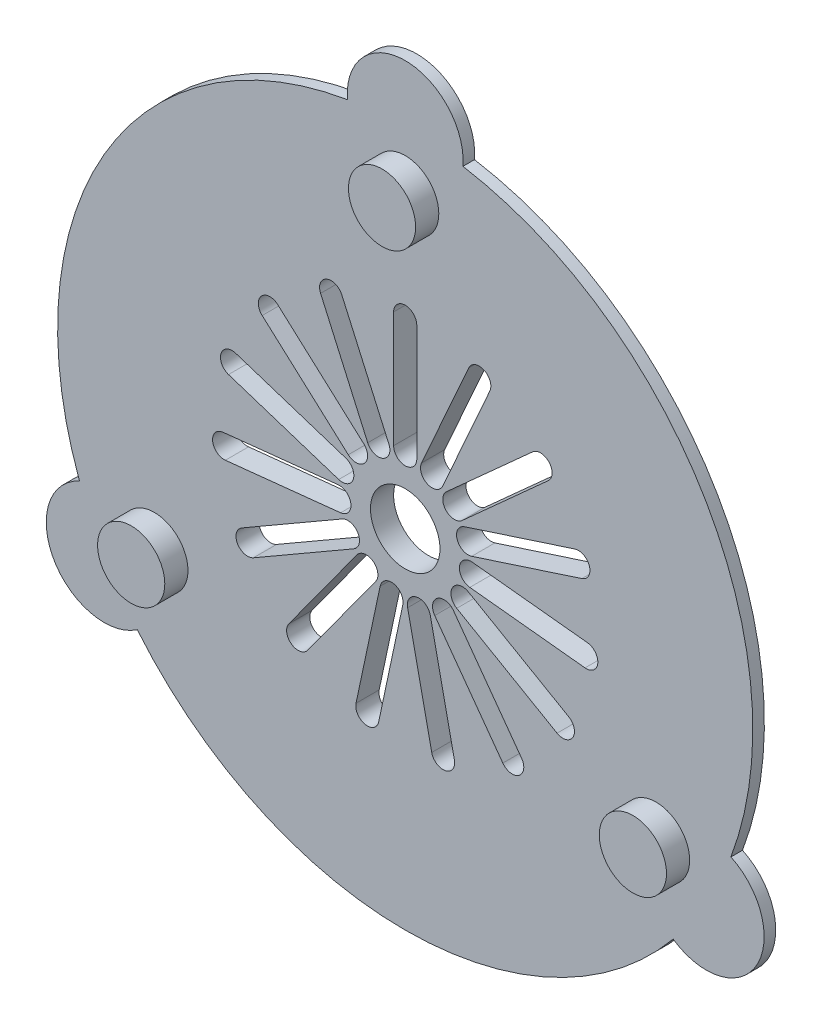
from build123d import *

# Parameters (mm, degrees)
SKETCH2_R           = 18.85
SKETCH2_R_2         = 3
BOSS_EXTRUDE1_DEPTH = 2
SKETCH3_R           = 30
SKETCH3_R_2         = 17.600030795
BOSS_EXTRUDE2_DEPTH = 1
SKETCH4_R           = 2.9
BOSS_EXTRUDE3_DEPTH = 2
SKETCH6_R           = 5
BOSS_EXTRUDE4_DEPTH = 1


with BuildPart() as part:
    # Sketch2 → Boss-Extrude1 (new body)
    with BuildSketch(Plane.XY.offset(10)):
        Circle(SKETCH2_R)
        with BuildLine():
            Line((-0.209387524, -5.794825197), (-2.288504433, -15.576301204))
            ThreePointArc((-2.288504433, -15.576301204), (-3.474563724, -16.346537114), (-4.244799634, -15.160477823))
            Line((-4.244799634, -15.160477823), (-2.165682726, -5.379001815))
            ThreePointArc((-2.165682726, -5.379001815), (-0.979623434, -4.608765905), (-0.209387524, -5.794825197))
        make_face(mode=Mode.SUBTRACT)
        with BuildLine():
            Line((-5.575910568, -1.591560096), (-15.521129522, -2.636844728))
            ThreePointArc((-15.521129522, -2.636844728), (-16.62017988, -1.746851296), (-15.730186448, -0.647800938))
            Line((-15.730186448, -0.647800938), (-5.784967494, 0.397483695))
            ThreePointArc((-5.784967494, 0.397483695), (-4.685917136, -0.492509737), (-5.575910568, -1.591560096))
        make_face(mode=Mode.SUBTRACT)
        with BuildLine():
            Line((-2.54825277, -5.208670658), (-8.426105293, -13.298840602))
            ThreePointArc((-8.426105293, -13.298840602), (-9.822907539, -13.520072344), (-10.044139281, -12.123270097))
            Line((-10.044139281, -12.123270097), (-4.166286758, -4.033100153))
            ThreePointArc((-4.166286758, -4.033100153), (-2.769484512, -3.811868411), (-2.54825277, -5.208670658))
        make_face(mode=Mode.SUBTRACT)
        with BuildLine():
            Line((-4.446501961, -3.721889642), (-13.106755999, -8.721889642))
            ThreePointArc((-13.106755999, -8.721889642), (-14.472781403, -8.355864239), (-14.106755999, -6.989838835))
            Line((-14.106755999, -6.989838835), (-5.446501961, -1.989838835))
            ThreePointArc((-5.446501961, -1.989838835), (-4.080476557, -2.355864239), (-4.446501961, -3.721889642))
        make_face(mode=Mode.SUBTRACT)
        with BuildLine():
            Line((2.165682726, -5.379001815), (4.244799634, -15.160477823))
            ThreePointArc((4.244799634, -15.160477823), (3.474563724, -16.346537114), (2.288504433, -15.576301204))
            Line((2.288504433, -15.576301204), (0.209387524, -5.794825197))
            ThreePointArc((0.209387524, -5.794825197), (0.979623434, -4.608765905), (2.165682726, -5.379001815))
        make_face(mode=Mode.SUBTRACT)
        with BuildLine():
            Line((4.166286758, -4.033100153), (10.044139281, -12.123270097))
            ThreePointArc((10.044139281, -12.123270097), (9.822907539, -13.520072344), (8.426105293, -13.298840602))
            Line((8.426105293, -13.298840602), (2.54825277, -5.208670658))
            ThreePointArc((2.54825277, -5.208670658), (2.769484512, -3.811868411), (4.166286758, -4.033100153))
        make_face(mode=Mode.SUBTRACT)
        with BuildLine():
            Line((5.446501961, -1.989838835), (14.106755999, -6.989838835))
            ThreePointArc((14.106755999, -6.989838835), (14.472781403, -8.355864239), (13.106755999, -8.721889642))
            Line((13.106755999, -8.721889642), (4.446501961, -3.721889642))
            ThreePointArc((4.446501961, -3.721889642), (4.080476557, -2.355864239), (5.446501961, -1.989838835))
        make_face(mode=Mode.SUBTRACT)
        with BuildLine():
            Line((5.784967494, 0.397483695), (15.730186448, -0.647800938))
            ThreePointArc((15.730186448, -0.647800938), (16.62017988, -1.746851296), (15.521129522, -2.636844728))
            Line((15.521129522, -2.636844728), (5.575910568, -1.591560096))
            ThreePointArc((5.575910568, -1.591560096), (4.685917136, -0.492509737), (5.784967494, 0.397483695))
        make_face(mode=Mode.SUBTRACT)
        with BuildLine():
            Line((-5.741193582, 0.81396465), (-15.251758745, 3.904134594))
            ThreePointArc((-15.251758745, 3.904134594), (-15.893798267, 5.164208105), (-14.633724756, 5.806247627))
            Line((-14.633724756, 5.806247627), (-5.123159593, 2.716077683))
            ThreePointArc((-5.123159593, 2.716077683), (-4.481120071, 1.456004172), (-5.741193582, 0.81396465))
        make_face(mode=Mode.SUBTRACT)
        with BuildLine():
            Line((-4.913772069, 3.078747514), (-12.345220324, 9.770053578))
            ThreePointArc((-12.345220324, 9.770053578), (-12.419234543, 11.182329009), (-11.006959111, 11.256343229))
            Line((-11.006959111, 11.256343229), (-3.575510856, 4.565037165))
            ThreePointArc((-3.575510856, 4.565037165), (-3.501496637, 3.152761733), (-4.913772069, 3.078747514))
        make_face(mode=Mode.SUBTRACT)
        with BuildLine():
            Line((-3.236714725, 4.811186963), (-7.304081155, 13.946641539))
            ThreePointArc((-7.304081155, 13.946641539), (-6.797272341, 15.26692364), (-5.47699024, 14.760114825))
            Line((-5.47699024, 14.760114825), (-1.409623809, 5.624660249))
            ThreePointArc((-1.409623809, 5.624660249), (-1.916432624, 4.304378148), (-3.236714725, 4.811186963))
        make_face(mode=Mode.SUBTRACT)
        Circle(SKETCH2_R_2, mode=Mode.SUBTRACT)
        with BuildLine():
            Line((3.575510856, 4.565037165), (11.006959111, 11.256343229))
            ThreePointArc((11.006959111, 11.256343229), (12.419234543, 11.182329009), (12.345220324, 9.770053578))
            Line((12.345220324, 9.770053578), (4.913772069, 3.078747514))
            ThreePointArc((4.913772069, 3.078747514), (3.501496637, 3.152761733), (3.575510856, 4.565037165))
        make_face(mode=Mode.SUBTRACT)
        with BuildLine():
            Line((5.123159593, 2.716077683), (14.633724756, 5.806247627))
            ThreePointArc((14.633724756, 5.806247627), (15.893798267, 5.164208105), (15.251758745, 3.904134594))
            Line((15.251758745, 3.904134594), (5.741193582, 0.81396465))
            ThreePointArc((5.741193582, 0.81396465), (4.481120071, 1.456004172), (5.123159593, 2.716077683))
        make_face(mode=Mode.SUBTRACT)
        with BuildLine():
            ThreePointArc((-1, 15.711728477), (0, 16.711728477), (1, 15.711728477))
            Line((1, 15.711728477), (1, 5.711728477))
            ThreePointArc((1, 5.711728477), (0, 4.711728477), (-1, 5.711728477))
            Line((-1, 5.711728477), (-1, 15.711728477))
        make_face(mode=Mode.SUBTRACT)
        with BuildLine():
            Line((1.409623809, 5.624660249), (5.47699024, 14.760114825))
            ThreePointArc((5.47699024, 14.760114825), (6.797272341, 15.26692364), (7.304081155, 13.946641539))
            Line((7.304081155, 13.946641539), (3.236714725, 4.811186963))
            ThreePointArc((3.236714725, 4.811186963), (1.916432624, 4.304378148), (1.409623809, 5.624660249))
        make_face(mode=Mode.SUBTRACT)
    extrude(amount=BOSS_EXTRUDE1_DEPTH)

    # Sketch3 → Boss-Extrude2 (add)
    with BuildSketch(Plane.XY.offset(12)):
        Circle(SKETCH3_R)
        Circle(SKETCH3_R_2, mode=Mode.SUBTRACT)
    extrude(amount=-BOSS_EXTRUDE2_DEPTH)

    # Sketch4 → Boss-Extrude3 (add)
    with BuildSketch(Plane.XY.offset(12)):
        with Locations((0, 25)):
            Circle(SKETCH4_R)
        with Locations((21.650635095, -12.5)):
            Circle(SKETCH4_R)
        with Locations((-21.650635095, -12.5)):
            Circle(SKETCH4_R)
    extrude(amount=BOSS_EXTRUDE3_DEPTH)

    # Sketch6 → Boss-Extrude4 (add)
    with BuildSketch(Plane(origin=(0, 0, 11), x_dir=(-1, 0, 0), z_dir=(0, 0, -1))):
        with Locations((0, 30)):
            Circle(SKETCH6_R)
        with Locations((25.980762114, -15)):
            Circle(SKETCH6_R)
        with Locations((-25.980762114, -15)):
            Circle(SKETCH6_R)
    extrude(amount=-BOSS_EXTRUDE4_DEPTH)


solid = part.part
